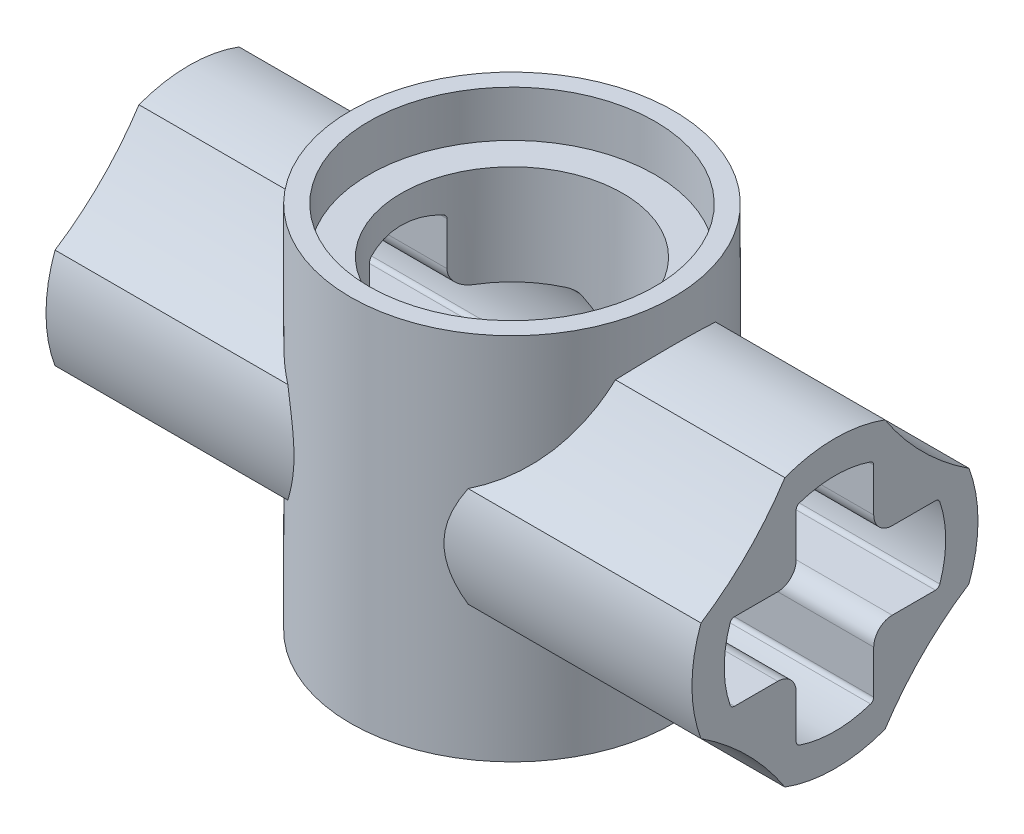
from build123d import *

# Parameters (mm, degrees)
BOSS_EXTRUDE1_DEPTH = 14
FILLET1_R           = 6.2
FILLET2_R           = 6.2
FILLET3_R           = 6.2
FILLET4_R           = 6.2
SKETCH3_R           = 3.5
BOSS_EXTRUDE2_DEPTH = 4
CUT_EXTRUDE1_DEPTH  = 15.974979275
FILLET5_R           = 0.4
FILLET6_R           = 0.4
FILLET7_R           = 0.4
FILLET8_R           = 0.4
FILLET9_R           = 0.1
FILLET10_R          = 0.1
FILLET11_R          = 0.1
FILLET12_R          = 0.1
FILLET13_R          = 0.1
FILLET14_R          = 0.1
FILLET15_R          = 0.1
FILLET16_R          = 0.1
SKETCH4_R           = 2.4
CUT_EXTRUDE2_DEPTH  = 17.500000155
SKETCH5_R           = 3.1
CUT_EXTRUDE3_DEPTH  = 1


with BuildPart() as part:
    # Sketch1 → Boss-Extrude1 (new body)
    with BuildSketch(Plane(origin=(0, 0, 0), x_dir=(0, 0, -1), z_dir=(1, 0, 0))):
        with BuildLine():
            Line((1.085, -1.085), (2.903924069, -1.085))
            ThreePointArc((2.903924069, -1.085), (3.1, 0), (2.903924069, 1.085))
            Line((2.903924069, 1.085), (1.085, 1.085))
            Line((1.085, 1.085), (1.085, 2.903924069))
            ThreePointArc((1.085, 2.903924069), (0, 3.1), (-1.085, 2.903924069))
            Line((-1.085, 2.903924069), (-1.085, 1.085))
            Line((-1.085, 1.085), (-2.903924069, 1.085))
            ThreePointArc((-2.903924069, 1.085), (-3.1, 0), (-2.903924069, -1.085))
            Line((-2.903924069, -1.085), (-1.085, -1.085))
            Line((-1.085, -1.085), (-1.085, -2.903924069))
            ThreePointArc((-1.085, -2.903924069), (0, -3.1), (1.085, -2.903924069))
            Line((1.085, -2.903924069), (1.085, -1.085))
        make_face()
    extrude(amount=-BOSS_EXTRUDE1_DEPTH)

    # Fillet1
    # the kernel refuses this fillet: 6.2 mm, written as the material it adds along each edge
    with BuildSketch(Plane(origin=(0, 1.085, -1.085), x_dir=(0, 0, -1), z_dir=(-1, 0, 0))) as fillet1_piece_1:
        with BuildLine():
            CenterArc((5.198154004, -5.198154004), FILLET1_R, 123.027198012, 23.945603977)
            Line((0, -1.818924069), (0, 0))
            Line((0, 0), (1.818924069, 0))
        make_face()
    extrude(amount=14)

    # Fillet2
    # the kernel refuses this fillet: 6.2 mm, written as the material it adds along each edge
    with BuildSketch(Plane(origin=(0, 1.085, 1.085), x_dir=(0, 1, 0), z_dir=(-1, 0, 0))) as fillet2_piece_1:
        with BuildLine():
            CenterArc((5.198154004, -5.198154004), FILLET2_R, 123.027198012, 23.945603977)
            Line((0, -1.818924069), (0, 0))
            Line((0, 0), (1.818924069, 0))
        make_face()
    extrude(amount=14)

    # Fillet3
    # the kernel refuses this fillet: 6.2 mm, written as the material it adds along each edge
    with BuildSketch(Plane(origin=(0, -1.085, 1.085), x_dir=(0, 0, 1), z_dir=(-1, 0, 0))) as fillet3_piece_1:
        with BuildLine():
            CenterArc((5.198154004, -5.198154004), FILLET3_R, 123.027198012, 23.945603977)
            Line((0, -1.818924069), (0, 0))
            Line((0, 0), (1.818924069, 0))
        make_face()
    extrude(amount=14)

    # Fillet4
    # the kernel refuses this fillet: 6.2 mm, written as the material it adds along each edge
    with BuildSketch(Plane(origin=(0, -1.085, -1.085), x_dir=(0, -1, 0), z_dir=(-1, 0, 0))) as fillet4_piece_1:
        with BuildLine():
            CenterArc((5.198154004, -5.198154004), FILLET4_R, 123.027198012, 23.945603977)
            Line((0, -1.818924069), (0, 0))
            Line((0, 0), (1.818924069, 0))
        make_face()
    extrude(amount=14)

    # Sketch3 → Boss-Extrude2 (add, symmetric)
    with BuildSketch(Plane(origin=(0, 0, 0), x_dir=(1, 0, 0), z_dir=(0, 1, 0))):
        with Locations(Location((-7, 0, 0), (0, 0, 270))):
            Circle(SKETCH3_R)
    extrude(amount=BOSS_EXTRUDE2_DEPTH, both=True)

    # Sketch2 → Cut-Extrude1 (cut, through all)
    with BuildSketch(Plane(origin=(0, 0, 0), x_dir=(0, 0, -1), z_dir=(1, 0, 0))):
        with BuildLine():
            Line((0.84, -0.84), (0.84, -2.248199279))
            ThreePointArc((0.84, -2.248199279), (0, -2.4), (-0.84, -2.248199279))
            Line((-0.84, -2.248199279), (-0.84, -0.84))
            Line((-0.84, -0.84), (-2.248199279, -0.84))
            ThreePointArc((-2.248199279, -0.84), (-2.4, 0), (-2.248199279, 0.84))
            Line((-2.248199279, 0.84), (-0.84, 0.84))
            Line((-0.84, 0.84), (-0.84, 2.248199279))
            ThreePointArc((-0.84, 2.248199279), (0, 2.4), (0.84, 2.248199279))
            Line((0.84, 2.248199279), (0.84, 0.84))
            Line((0.84, 0.84), (2.248199279, 0.84))
            ThreePointArc((2.248199279, 0.84), (2.4, 0), (2.248199279, -0.84))
            Line((2.248199279, -0.84), (0.84, -0.84))
        make_face()
    extrude(amount=-CUT_EXTRUDE1_DEPTH, mode=Mode.SUBTRACT)

    # Fillet5
    fillet5_edges = [part.edges().sort_by_distance(p)[0] for p in [
        (-7, 0.84, -0.84),
    ]]
    fillet(fillet5_edges, radius=FILLET5_R)

    # Fillet6
    fillet6_edges = [part.edges().sort_by_distance(p)[0] for p in [
        (-7, 0.84, 0.84),
    ]]
    fillet(fillet6_edges, radius=FILLET6_R)

    # Fillet7
    fillet7_edges = [part.edges().sort_by_distance(p)[0] for p in [
        (-7, -0.84, 0.84),
    ]]
    fillet(fillet7_edges, radius=FILLET7_R)

    # Fillet8
    fillet8_edges = [part.edges().sort_by_distance(p)[0] for p in [
        (-7, -0.84, -0.84),
    ]]
    fillet(fillet8_edges, radius=FILLET8_R)

    # Fillet9
    fillet9_edges = [part.edges().sort_by_distance(p)[0] for p in [
        (-7, -2.248199279, 0.84),
    ]]
    fillet(fillet9_edges, radius=FILLET9_R)

    # Fillet10
    fillet10_edges = [part.edges().sort_by_distance(p)[0] for p in [
        (-7, -2.248199279, -0.84),
    ]]
    fillet(fillet10_edges, radius=FILLET10_R)

    # Fillet11
    fillet11_edges = [part.edges().sort_by_distance(p)[0] for p in [
        (-7, 0.84, 2.248199279),
    ]]
    fillet(fillet11_edges, radius=FILLET11_R)

    # Fillet12
    fillet12_edges = [part.edges().sort_by_distance(p)[0] for p in [
        (-7, -0.84, 2.248199279),
    ]]
    fillet(fillet12_edges, radius=FILLET12_R)

    # Fillet13
    fillet13_edges = [part.edges().sort_by_distance(p)[0] for p in [
        (-7, 2.248199279, 0.84),
    ]]
    fillet(fillet13_edges, radius=FILLET13_R)

    # Fillet14
    fillet14_edges = [part.edges().sort_by_distance(p)[0] for p in [
        (-7, 2.248199279, -0.84),
    ]]
    fillet(fillet14_edges, radius=FILLET14_R)

    # Fillet15
    fillet15_edges = [part.edges().sort_by_distance(p)[0] for p in [
        (-7, 0.84, -2.248199279),
    ]]
    fillet(fillet15_edges, radius=FILLET15_R)

    # Fillet16
    fillet16_edges = [part.edges().sort_by_distance(p)[0] for p in [
        (-7, -0.84, -2.248199279),
    ]]
    fillet(fillet16_edges, radius=FILLET16_R)

    # Sketch4 → Cut-Extrude2 (cut, through all)
    with BuildSketch(Plane(origin=(0, 4, 0), x_dir=(1, 0, 0), z_dir=(0, 1, 0))):
        with Locations(Location((-7, 0, 0), (0, 0, 270))):
            Circle(SKETCH4_R)
    extrude(amount=-CUT_EXTRUDE2_DEPTH, mode=Mode.SUBTRACT)

    # Sketch5 → Cut-Extrude3 (cut)
    with BuildSketch(Plane(origin=(0, 4, 0), x_dir=(1, 0, 0), z_dir=(0, 1, 0))):
        with Locations(Location((-7, 0, 0), (0, 0, 270))):
            Circle(SKETCH5_R)
    cut_extrude3 = extrude(amount=-CUT_EXTRUDE3_DEPTH, mode=Mode.SUBTRACT)

    # Mirror1: Cut-Extrude3 across plane
    add(cut_extrude3.mirror(Plane.ZX), mode=Mode.SUBTRACT)


solid = part.part
